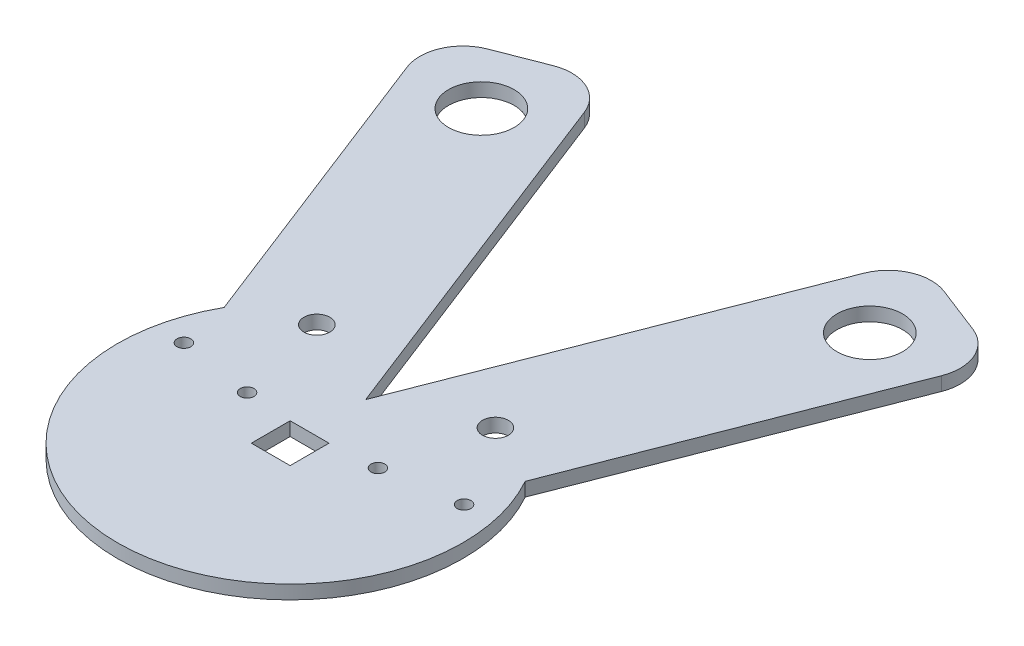
from build123d import *

# Parameters (mm, degrees)
SKETCH1_R           = 1.6
SKETCH1_R_2         = 3
SKETCH1_R_3         = 7.6
SKETCH1_W           = 9
SKETCH1_H           = 9
BOSS_EXTRUDE1_DEPTH = 3.175
FILLET1_R           = 10
MIRROR2_OUTLINE_R   = 3
MIRROR2_OUTLINE_R_2 = 1.6
MIRROR2_DEPTH       = 3.175


# Read off the part's stored shape, not the designer's step: Mirror2
with BuildPart() as part:
    # Sketch1 → Boss-Extrude1 (new body)
    # profile 1 of 2: a face of its own
    with BuildSketch(Plane(origin=(0, 0, 0), x_dir=(1, 0, 0), z_dir=(0, 1, 0))):
        with BuildLine():
            ThreePointArc((23.66850222, -9.217483532), (0, -25.4), (-23.66850222, -9.217483532))
            Line((-23.66850222, -9.217483532), (-65.553741095, 98.334742178))
            Line((-65.553741095, 98.334742178), (-35.96811332, 109.856596592))
            Line((-35.96811332, 109.856596592), (0, 17.498268312))
            Line((0, 17.498268312), (35.96811332, 109.856596592))
            Line((35.96811332, 109.856596592), (65.553741095, 98.334742178))
            Line((65.553741095, 98.334742178), (23.66850222, -9.217483532))
        make_face()
        with Locations(Location((-15.161153788, 5.181560445, 0), (0, 0, 270))):
            Circle(SKETCH1_R, mode=Mode.SUBTRACT)
        with Locations(Location((-20.686165487, 26.870192161, 0), (0, 0, 270))):
            Circle(SKETCH1_R_2, mode=Mode.SUBTRACT)
        with Locations(Location((-45, 89.302855497, 0), (0, 0, 270))):
            Circle(SKETCH1_R_3, mode=Mode.SUBTRACT)
        with Locations(Location((45, 89.302855497, 0), (0, 0, 270))):
            Circle(SKETCH1_R_3, mode=Mode.SUBTRACT)
        Rectangle(SKETCH1_W, SKETCH1_H, mode=Mode.SUBTRACT)
    # profile 2 of 2: a face of its own
    with BuildSketch(Plane(origin=(0, 0, 0), x_dir=(1, 0, 0), z_dir=(0, 1, 0))):
        with BuildLine():
            Line((-23.66850222, -9.217483532), (-34.882073701, 19.576540408))
            ThreePointArc((-34.882073701, 19.576540408), (0, -40), (34.882073701, 19.576540408))
            Line((34.882073701, 19.576540408), (23.66850222, -9.217483532))
            ThreePointArc((23.66850222, -9.217483532), (0, -25.4), (-23.66850222, -9.217483532))
        make_face()
        with Locations(Location((-32.458777971, 7.835274371, 0), (0, 0, 270))):
            Circle(SKETCH1_R, mode=Mode.SUBTRACT)
    extrude(amount=BOSS_EXTRUDE1_DEPTH)

    # Fillet1
    fillet1_edges = [part.edges().sort_by_distance(p)[0] for p in [
        (-65.553741095, 1.5875, -98.334742178),
        (-35.96811332, 1.5875, -109.856596592),
        (35.96811332, 1.5875, -109.856596592),
        (65.553741095, 1.5875, -98.334742178),
    ]]
    fillet(fillet1_edges, radius=FILLET1_R)

    # Mirror2 outline → Mirror2 (cut)
    with BuildSketch(Plane(origin=(0, 0, 0), x_dir=(1, 0, 0), z_dir=(0, 1, 0))):
        with Locations((20.686165487, 26.870192161)):
            Circle(MIRROR2_OUTLINE_R)
        with Locations((15.161153788, 5.181560445)):
            Circle(MIRROR2_OUTLINE_R_2)
        with Locations((32.458777971, 7.835274371)):
            Circle(MIRROR2_OUTLINE_R_2)
    extrude(amount=MIRROR2_DEPTH, mode=Mode.SUBTRACT)


solid = part.part
